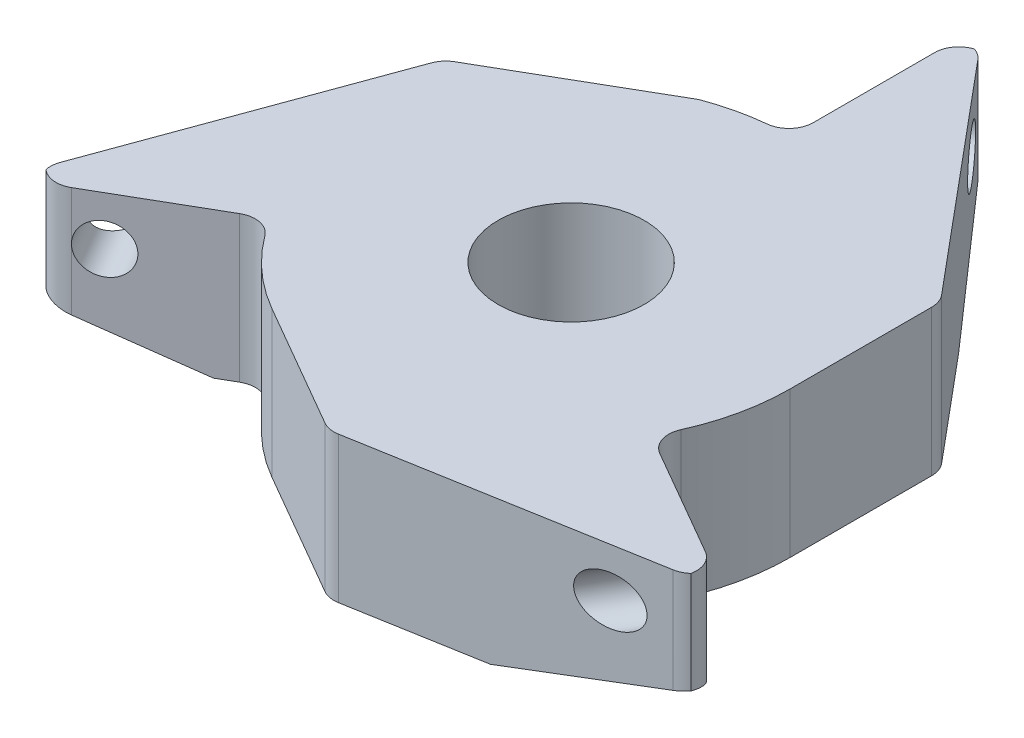
from build123d import *

# Parameters (mm, degrees)
SKETCH1_R           = 3
BOSS_EXTRUDE1_DEPTH = 6
SKETCH2_R           = 1
CUT_EXTRUDE1_DEPTH  = 23.192051803
CIRPATTERN1_COUNT   = 3


with BuildPart() as part:
    # Sketch1 → Boss-Extrude1 (new body)
    with BuildSketch(Plane(origin=(0, 0, 0), x_dir=(1, 0, 0), z_dir=(0, 1, 0))):
        with BuildLine():
            Line((0, 9.949874371), (0, 14.931500001))
            ThreePointArc((0, 14.931500001), (0.189758469, 15.51759612), (0.687017323, 15.881258835))
            ThreePointArc((0.687017323, 15.881258835), (0.935555017, 15.758962914), (1.141008782, 15.573178015))
            Line((1.141008782, 15.573178015), (8.766974136, 6.458142033))
            ThreePointArc((8.766974136, 6.458142033), (8.939939928, 6.157803926), (9, 5.816464019))
            Line((9, 5.816464019), (9, 0))
            ThreePointArc((9, 0), (8.79904643, -1.891238198), (8.205159573, -3.698020604))
            ThreePointArc((8.205159573, -3.698020604), (8.165086544, -4.415763214), (8.61684397, -4.974937186))
            Line((8.61684397, -4.974937186), (13.049703796, -7.53425))
            ThreePointArc((13.049703796, -7.53425), (13.46239869, -7.991633714), (13.528710413, -8.604103871))
            ThreePointArc((13.528710413, -8.604103871), (13.298530191, -8.758195867), (13.034908867, -8.843231598))
            Line((13.034908867, -8.843231598), (1.328073473, -10.889993332))
            ThreePointArc((1.328073473, -10.889993332), (0.981490146, -10.889617048), (0.655851079, -10.770960643))
            Line((0.655851079, -10.770960643), (-4.5, -7.794228634))
            ThreePointArc((-4.5, -7.794228634), (-5.997456612, -6.71047794), (-7.241917412, -5.34365345))
            ThreePointArc((-7.241917412, -5.34365345), (-7.842273701, -4.958484648), (-8.546574902, -5.071367319))
            Line((-8.546574902, -5.071367319), (-12.931058317, -7.602749999))
            ThreePointArc((-12.931058317, -7.602749999), (-13.53351168, -7.731462404), (-14.097082257, -7.482654962))
            ThreePointArc((-14.097082257, -7.482654962), (-14.115439729, -7.206267044), (-14.05727217, -6.935446415))
            Line((-14.05727217, -6.935446415), (-9.97640213, 4.226351301))
            ThreePointArc((-9.97640213, 4.226351301), (-9.802784595, 4.526313125), (-9.537205601, 4.748996626))
            Line((-9.537205601, 4.748996626), (-3.17926678, 8.419754316))
            ThreePointArc((-3.17926678, 8.419754316), (-2.057108673, 8.761752331), (-0.9, 8.954886934))
            ThreePointArc((-0.9, 8.954886934), (-0.258380151, 9.279053978), (0, 9.949874371))
        make_face()
        Circle(SKETCH1_R, mode=Mode.SUBTRACT)
    extrude(amount=BOSS_EXTRUDE1_DEPTH)

    # Sketch2 → Cut-Extrude1 (cut, through all)
    with BuildSketch(Plane(origin=(0.059322739, 0, 0.102749999), x_dir=(0.8660254037844388, 0, -0.49999999999999983), z_dir=(0.4999999999999998, 0, 0.8660254037844387))):
        with Locations((-14, 4)):
            Circle(SKETCH2_R)
        Polygon((-16.333715653, 1.923120107), (-10.056863633, -0.231620139), (-16.333715653, -0.231620139), align=None)
    cut_extrude1 = extrude(amount=-CUT_EXTRUDE1_DEPTH, mode=Mode.SUBTRACT)

    # CirPattern1: Cut-Extrude1 ×3 about axis
    cirpattern1_axis = Axis((0, 6, 0), (0, 1, 0))
    for i in range(1, CIRPATTERN1_COUNT):
        add(cut_extrude1.rotate(cirpattern1_axis, i * 360 / CIRPATTERN1_COUNT), mode=Mode.SUBTRACT)


solid = part.part
